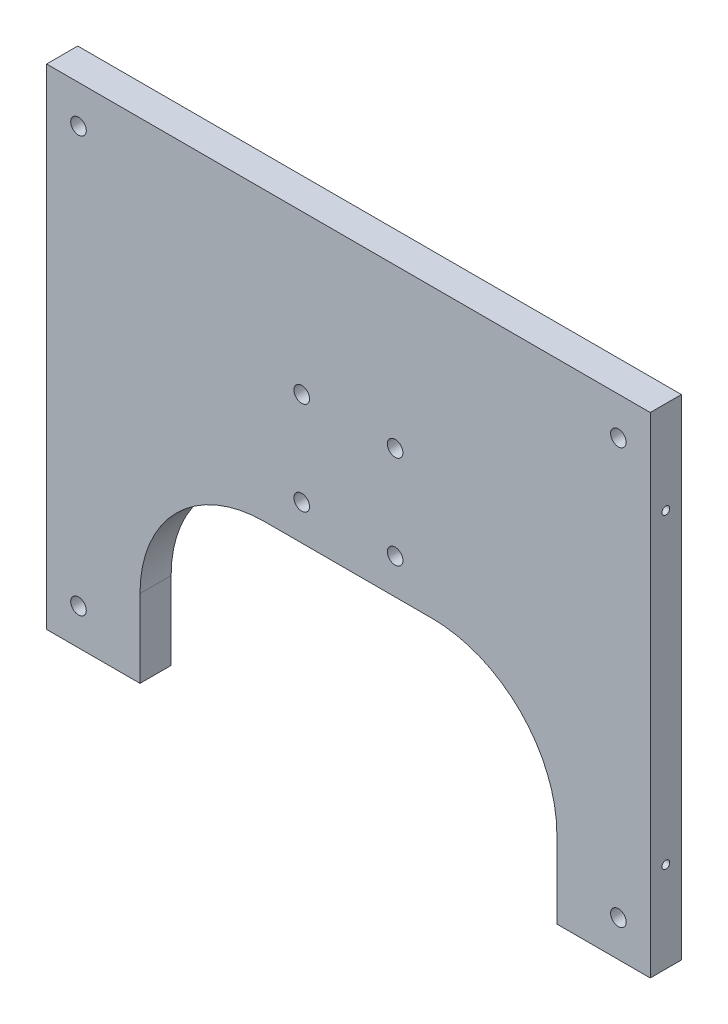
from build123d import *

# Parameters (mm, degrees)
BOSS_EXTRUDE1_DEPTH         = 12.7
F_1_4_0_25_DIAMETER_HOLE1_D = 6.35
FILLET2_R                   = 50.8
HOLE1_AT_2_COUNT            = 2
HOLE1_AT_2_PITCH            = 125.108514383


with BuildPart() as part:
    # Sketch1 → Boss-Extrude1 (new body)
    with BuildSketch(Plane.XY):
        Polygon((258.933482757, 10.713854335), (12.7, 10.713854335), (12.7, -189.051843155), (50.8, -189.051843155), (50.8, -106.501843155), (220.833482757, -106.501843155), (220.833482757, -189.051843155), (258.933482757, -189.051843155), align=None)
    extrude(amount=-BOSS_EXTRUDE1_DEPTH)

    # 1/4 (0.25) Diameter Hole1 (through all)
    with Locations(Plane(origin=(0, 0, -12.7), x_dir=(-1, 0, 0), z_dir=(0, 0, -1))):
        with Locations((-25.706162889, -174.233423282), (-116.766741379, -92.064314729), (-154.866741379, -92.064314729), (-245.927319868, -174.233423282), (-154.866741379, -53.964314729), (-245.927319868, -4.747970506), (-116.766741379, -53.964314729), (-25.706162889, -4.747970506)):
            Hole(F_1_4_0_25_DIAMETER_HOLE1_D / 2)

    # Fillet2
    fillet2_edges = [part.edges().sort_by_distance(p)[0] for p in [
        (220.833482757, -106.501843155, -6.35),
        (50.8, -106.501843155, -6.35),
    ]]
    fillet(fillet2_edges, radius=FILLET2_R)

    # Sketch7 → Hole1 (revolve, cut)
    with BuildSketch(Plane(origin=(0, -152.193459623, -6.35), x_dir=(0, 0, 1), z_dir=(0, 1, 0))):
        Polygon((0, 0), (0, 39.053866233), (1.5875, 38.1), (1.5875, 4.017661662), (5.08, 0), align=None)
    hole1 = revolve(axis=Axis((-14.308894879, -152.193459623, -6.35), (1, 0, 0)), mode=Mode.SUBTRACT)

    # Hole1 at 2: Hole1 ×2
    with Locations(*[(0, i * HOLE1_AT_2_PITCH, 0) for i in range(1, HOLE1_AT_2_COUNT)]):
        add(hole1, mode=Mode.SUBTRACT)

    # Mirror1: Hole1 across plane
    add(hole1.mirror(Plane.ZY.offset(-135.816741379)), mode=Mode.SUBTRACT)

    # Mirror1 copy 1 sketch → Mirror1 copy 1 (revolve, cut)
    with BuildSketch(Plane(origin=(271.633482757, -27.08494524, -6.35), x_dir=(0, 0, 1), z_dir=(0, 1, 0))):
        Polygon((0, 0), (0, -39.053866233), (1.5875, -38.1), (1.5875, -4.017661662), (5.08, 0), align=None)
    revolve(axis=Axis((285.942377636, -27.08494524, -6.35), (1, 0, 0)), mode=Mode.SUBTRACT)


solid = part.part
